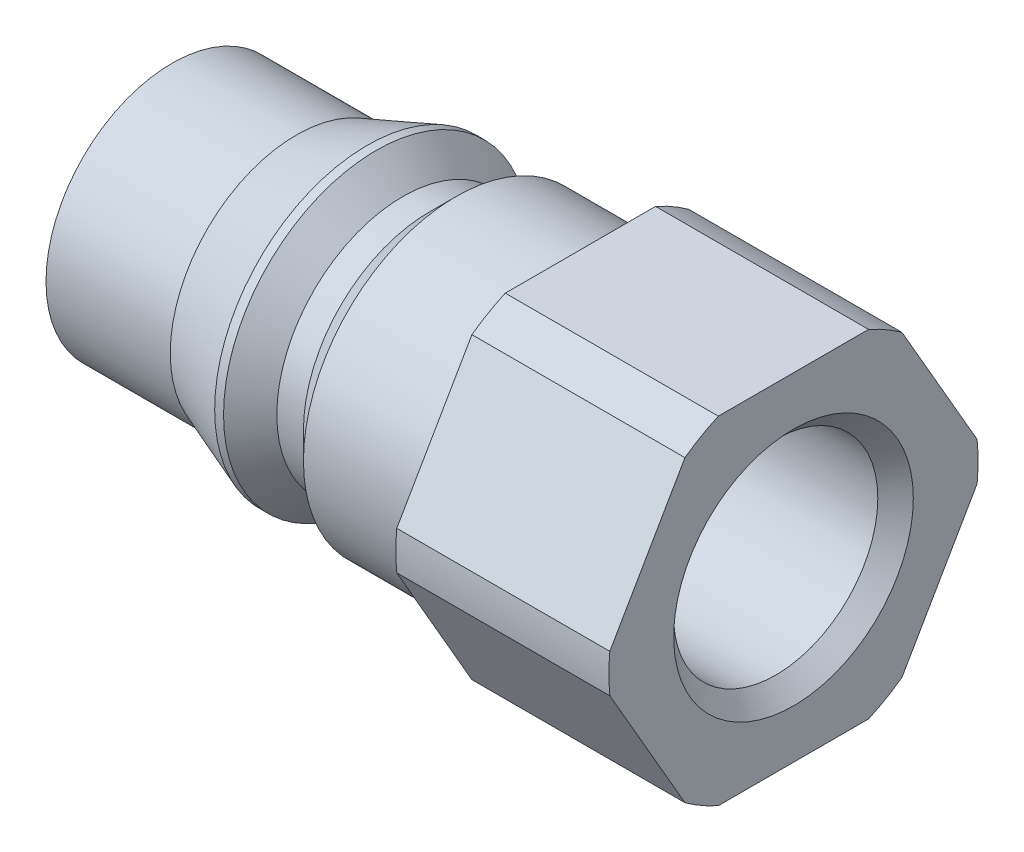
from build123d import *

# Parameters (mm, degrees)
CUT_EXTRUDE1_DEPTH       = 38.964720465
SCHIZZO1_R               = 5.75
TAGLIO_ESTRUSIONE1_DEPTH = 10
SMUSSO1_SIZE             = 1


with BuildPart() as part:
    # Sketch1 → Revolve1 (revolve)
    with BuildSketch(Plane.XY):
        Polygon((0, -7.1), (7, -7.1), (11, -8.6), (11.5, -8.6), (13, -7.1), (14.5, -7.1), (16, -8.6), (23, -8.6), (23, -10.4), (35, -10.4), (35, -3.175), (0, -3.175), align=None)
    revolve(axis=Axis((0, 0, 0), (1, 0, 0)))

    # Sketch2 → Cut-Extrude1 (cut, through all)
    with BuildSketch(Plane(origin=(35, 0, 0), x_dir=(0, 0, -1), z_dir=(1, 0, 0))):
        with BuildLine():
            Line((-10.343251733, 1.084962483), (-6.111230939, 8.415037517))
            ThreePointArc((-6.111230939, 8.415037517), (-9.006664199, 5.2), (-10.343251733, 1.084962483))
        make_face()
        with BuildLine():
            ThreePointArc((4.232020794, 9.5), (0, 10.4), (-4.232020794, 9.5))
            Line((-4.232020794, 9.5), (4.232020794, 9.5))
        make_face()
        with BuildLine():
            Line((-6.111230939, -8.415037517), (-10.343251733, -1.084962483))
            ThreePointArc((-10.343251733, -1.084962483), (-9.006664199, -5.2), (-6.111230939, -8.415037517))
        make_face()
        with BuildLine():
            ThreePointArc((10.343251733, 1.084962483), (9.006664199, 5.2), (6.111230939, 8.415037517))
            Line((6.111230939, 8.415037517), (10.343251733, 1.084962483))
        make_face()
        with BuildLine():
            Line((4.232020794, -9.5), (-4.232020794, -9.5))
            ThreePointArc((-4.232020794, -9.5), (0, -10.4), (4.232020794, -9.5))
        make_face()
        with BuildLine():
            ThreePointArc((6.111230939, -8.415037517), (9.006664199, -5.2), (10.343251733, -1.084962483))
            Line((10.343251733, -1.084962483), (6.111230939, -8.415037517))
        make_face()
    extrude(amount=-CUT_EXTRUDE1_DEPTH, mode=Mode.SUBTRACT)

    # Schizzo1 → Taglio-Estrusione1 (cut)
    with BuildSketch(Plane(origin=(35, 0, 0), x_dir=(0, 0, -1), z_dir=(1, 0, 0))):
        Circle(SCHIZZO1_R)
    extrude(amount=-TAGLIO_ESTRUSIONE1_DEPTH, mode=Mode.SUBTRACT)

    # Smusso1
    smusso1_edges = [part.edges().sort_by_distance(p)[0] for p in [
        (35, 0, 5.75),
    ]]
    chamfer(smusso1_edges, length=SMUSSO1_SIZE)


solid = part.part
